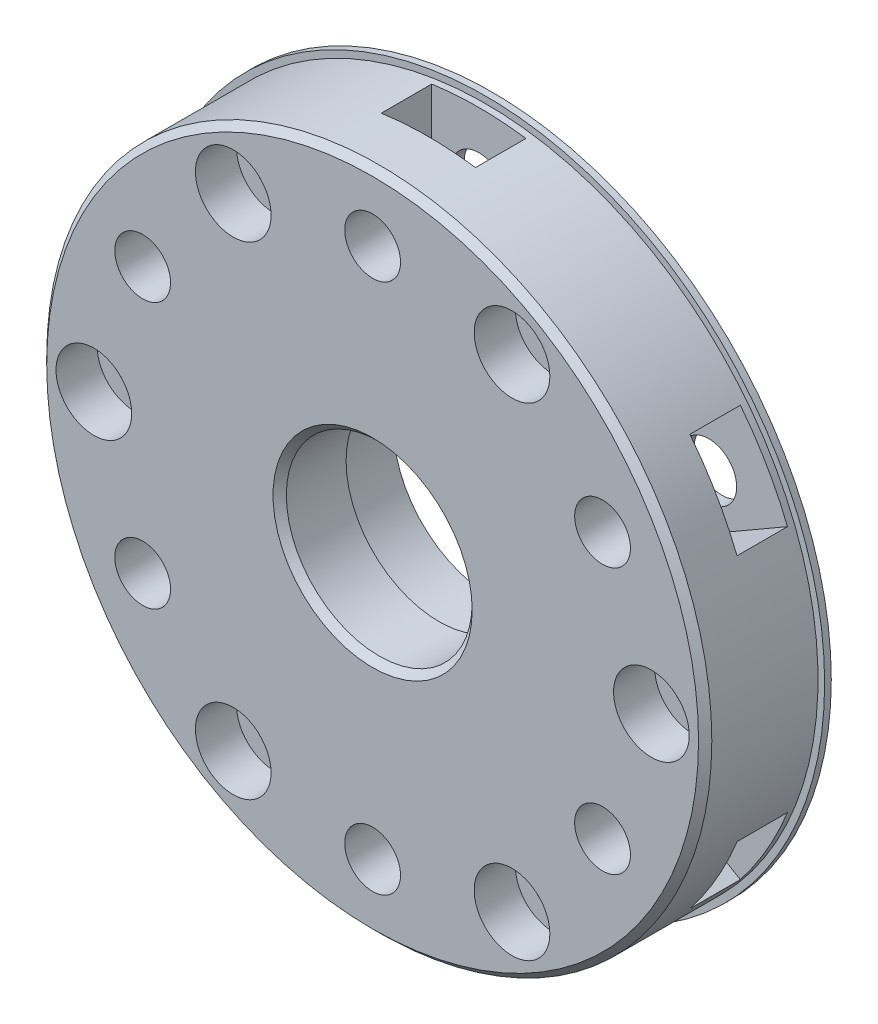
from build123d import *

# Parameters (mm, degrees)
OUTPUT_MASTER_SKETCH_R  = 25.05
BOSS_EXTRUDE1_DEPTH     = 9
SKETCH4_R               = 2.85
CUT_EXTRUDE1_DEPTH      = 4
SKETCH5_R               = 25.55
SKETCH5_R_2             = 25.05
BOSS_EXTRUDE2_DEPTH     = 0.5
SKETCH6_R               = 1.55
CUT_EXTRUDE2_DEPTH      = 38.237145433
CUT_EXTRUDE3_START      = -3.1
SKETCH7_R               = 2.85
CUT_EXTRUDE3_DEPTH      = 3.1
CHAMFER1_SIZE           = 0.5
SKETCH8_R               = 7
CUT_EXTRUDE4_DEPTH      = 10
SKETCH9_R               = 7.425
CUT_EXTRUDE5_DEPTH      = 4
SKETCH10_R              = 2.1
M4_THRU_DEPTH           = 38.237145433
CHAMFER3_SIZE           = 0.5
M4_START                = -8
M4_HEXNUT_CUT_DEPTH     = 3.8
SKETCH12_W              = 7.1
SKETCH12_H              = 3.8
M4_HEXNUT_SLOT_DEPTH    = 55.767908461
M4_HEXNUT_PATTERN_COUNT = 6


with BuildPart() as part:
    # Output Master Sketch → Boss-Extrude1 (new body)
    with BuildSketch(Plane.XY):
        Circle(OUTPUT_MASTER_SKETCH_R)
    extrude(amount=BOSS_EXTRUDE1_DEPTH)

    # Sketch4 → Cut-Extrude1 (cut)
    with BuildSketch(Plane.XY):
        with Locations((21, 0)):
            Circle(SKETCH4_R)
        with Locations((10.5, -18.186533479)):
            Circle(SKETCH4_R)
        with Locations((-10.5, -18.186533479)):
            Circle(SKETCH4_R)
        with Locations((-21, 0)):
            Circle(SKETCH4_R)
        with Locations((-10.5, 18.186533479)):
            Circle(SKETCH4_R)
        with Locations((10.5, 18.186533479)):
            Circle(SKETCH4_R)
    extrude(amount=CUT_EXTRUDE1_DEPTH, mode=Mode.SUBTRACT)

    # Sketch5 → Boss-Extrude2 (add)
    with BuildSketch(Plane(origin=(0, 0, 0), x_dir=(-1, 0, 0), z_dir=(0, 0, -1))):
        Circle(SKETCH5_R)
        Circle(SKETCH5_R_2, mode=Mode.SUBTRACT)
    extrude(amount=-BOSS_EXTRUDE2_DEPTH)

    # Sketch6 → Cut-Extrude2 (cut, through all)
    with BuildSketch(Plane(origin=(0, 0, 0), x_dir=(-1, 0, 0), z_dir=(0, 0, -1))):
        with Locations((-21, 0)):
            Circle(SKETCH6_R)
        with Locations((-10.5, 18.186533479)):
            Circle(SKETCH6_R)
        with Locations((10.5, 18.186533479)):
            Circle(SKETCH6_R)
        with Locations((21, 0)):
            Circle(SKETCH6_R)
        with Locations((10.5, -18.186533479)):
            Circle(SKETCH6_R)
        with Locations((-10.5, -18.186533479)):
            Circle(SKETCH6_R)
    extrude(amount=-CUT_EXTRUDE2_DEPTH, mode=Mode.SUBTRACT)

    # Sketch7 → Cut-Extrude3 (cut)
    with BuildSketch(Plane.XY.offset(9).offset(CUT_EXTRUDE3_START)):
        with Locations((-21, 0)):
            Circle(SKETCH7_R)
        with Locations((-10.5, 18.186533479)):
            Circle(SKETCH7_R)
        with Locations((10.5, 18.186533479)):
            Circle(SKETCH7_R)
        with Locations((21, 0)):
            Circle(SKETCH7_R)
        with Locations((10.5, -18.186533479)):
            Circle(SKETCH7_R)
        with Locations((-10.5, -18.186533479)):
            Circle(SKETCH7_R)
    extrude(amount=CUT_EXTRUDE3_DEPTH, mode=Mode.SUBTRACT)

    # Chamfer1
    chamfer1_edges = [part.edges().sort_by_distance(p)[0] for p in [
        (-25.05, 0, 9),
    ]]
    chamfer(chamfer1_edges, length=CHAMFER1_SIZE)

    # Sketch8 → Cut-Extrude4 (cut)
    with BuildSketch(Plane(origin=(0, 0, 0), x_dir=(-1, 0, 0), z_dir=(0, 0, -1))):
        Circle(SKETCH8_R)
    extrude(amount=-CUT_EXTRUDE4_DEPTH, mode=Mode.SUBTRACT)

    # Sketch9 → Cut-Extrude5 (cut)
    with BuildSketch(Plane(origin=(0, 0, 0), x_dir=(-1, 0, 0), z_dir=(0, 0, -1))):
        Circle(SKETCH9_R)
    extrude(amount=-CUT_EXTRUDE5_DEPTH, mode=Mode.SUBTRACT)

    # Sketch10 → M4 Thru (cut, through all)
    with BuildSketch(Plane.XY.offset(9)):
        with Locations((0, 20)):
            Circle(SKETCH10_R)
        with Locations((17.320508076, 10)):
            Circle(SKETCH10_R)
        with Locations((17.320508076, -10)):
            Circle(SKETCH10_R)
        with Locations((0, -20)):
            Circle(SKETCH10_R)
        with Locations((-17.320508076, -10)):
            Circle(SKETCH10_R)
        with Locations((-17.320508076, 10)):
            Circle(SKETCH10_R)
    extrude(amount=-M4_THRU_DEPTH, mode=Mode.SUBTRACT)

    # Chamfer3
    chamfer3_edges = [part.edges().sort_by_distance(p)[0] for p in [
        (7, 0, 9),
    ]]
    chamfer(chamfer3_edges, length=CHAMFER3_SIZE)

    # Sketch11 → M4 Hexnut Cut (cut)
    with BuildSketch(Plane.XY.offset(9).offset(M4_START)):
        Polygon((0, 24.099186911), (-3.55, 22.049593456), (-3.55, 17.950406544), (0, 15.900813089), (3.55, 17.950406544), (3.55, 22.049593456), align=None)
    m4_hexnut_cut = extrude(amount=M4_HEXNUT_CUT_DEPTH, mode=Mode.SUBTRACT)

    # Sketch12 → M4 Hexnut Slot (cut, through all)
    with BuildSketch(Plane(origin=(0, 22.049593456, 0), x_dir=(1, 0, 0), z_dir=(0, 1, 0))):
        with Locations((0, -2.9)):
            Rectangle(SKETCH12_W, SKETCH12_H)
    m4_hexnut_slot = extrude(amount=M4_HEXNUT_SLOT_DEPTH, mode=Mode.SUBTRACT)

    # M4 Hexnut Pattern: M4 Hexnut Cut, M4 Hexnut Slot ×6 about axis
    m4_hexnut_pattern_axis = Axis((0, 0, 10), (0, 0, -1))
    add([m4_hexnut_cut.rotate(m4_hexnut_pattern_axis, i * 360 / M4_HEXNUT_PATTERN_COUNT) for i in range(1, M4_HEXNUT_PATTERN_COUNT)], mode=Mode.SUBTRACT)
    add([m4_hexnut_slot.rotate(m4_hexnut_pattern_axis, i * 360 / M4_HEXNUT_PATTERN_COUNT) for i in range(1, M4_HEXNUT_PATTERN_COUNT)], mode=Mode.SUBTRACT)


solid = part.part
